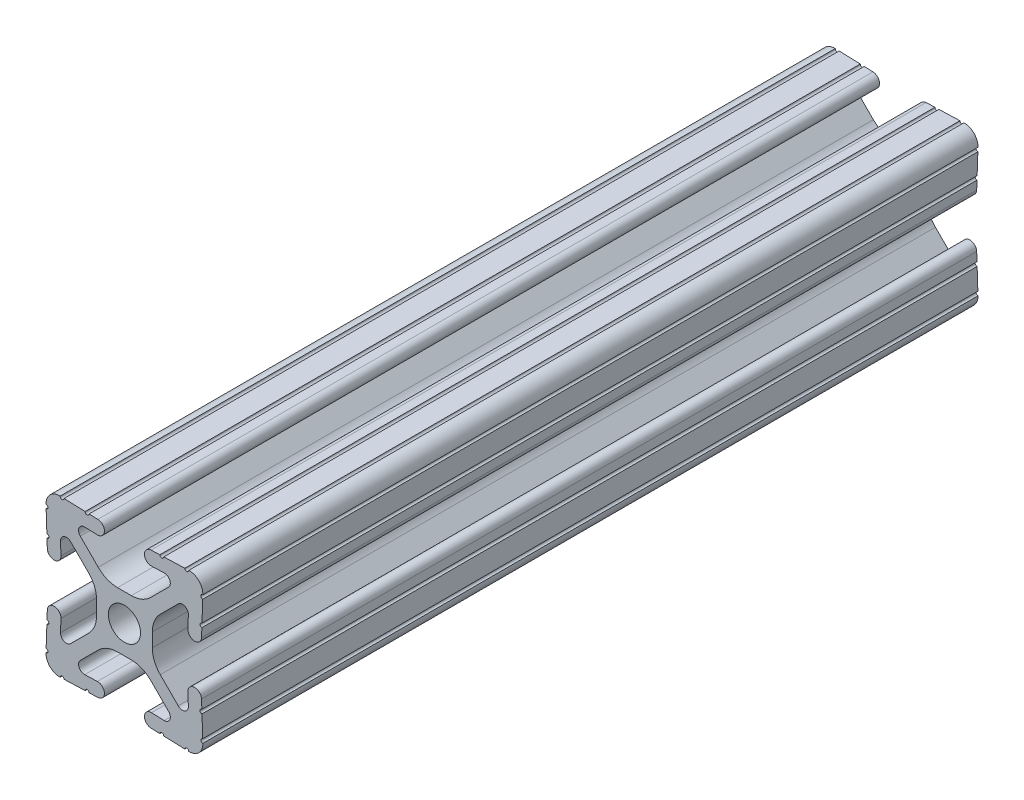
from build123d import *

# Parameters (mm, degrees)
SKETCH3_R      = 2.6035
EXTRUDE1_DEPTH = 62.75


with BuildPart() as part:
    # Sketch3 → Extrude1 (new, symmetric)
    with BuildSketch(Plane.XY):
        with BuildLine():
            Line((-1.115277175, 4.5085), (1.115277175, 4.5085))
            ThreePointArc((1.115277175, 4.5085), (2.806584872, 4.844922018), (4.240406305, 5.80297087))
            Line((4.240406305, 5.80297087), (7.148423664, 8.710988229))
            ThreePointArc((7.148423664, 8.710988229), (7.349906316, 9.772227925), (6.436353897, 10.348636575))
            Line((6.436353897, 10.348636575), (4.381960454, 10.276895575))
            ThreePointArc((4.381960454, 10.276895575), (3.239173075, 11.342562046), (4.304839546, 12.485349424))
            Line((4.304839546, 12.485349424), (5.728246175, 12.535055879))
            ThreePointArc((5.728246175, 12.535055879), (6.054756855, 12.230579745), (6.35923299, 12.557090424))
            Line((6.35923299, 12.557090424), (9.782092278, 12.676619304))
            ThreePointArc((9.782092278, 12.676619304), (10.108602958, 12.37214317), (10.413079092, 12.69865385))
            ThreePointArc((10.413079092, 12.69865385), (12.052764565, 12.052764565), (12.69865385, 10.413079092))
            ThreePointArc((12.69865385, 10.413079092), (12.37214317, 10.108602958), (12.676619304, 9.782092278))
            Line((12.676619304, 9.782092278), (12.557090424, 6.35923299))
            ThreePointArc((12.557090424, 6.35923299), (12.230579745, 6.054756855), (12.535055879, 5.728246175))
            Line((12.535055879, 5.728246175), (12.485349424, 4.304839546))
            ThreePointArc((12.485349424, 4.304839546), (11.342562046, 3.239173075), (10.276895575, 4.381960454))
            Line((10.276895575, 4.381960454), (10.348636575, 6.436353897))
            ThreePointArc((10.348636575, 6.436353897), (9.772227925, 7.349906316), (8.710988229, 7.148423664))
            Line((8.710988229, 7.148423664), (5.80297087, 4.240406305))
            ThreePointArc((5.80297087, 4.240406305), (4.844922018, 2.806584872), (4.5085, 1.115277175))
            Line((4.5085, 1.115277175), (4.5085, -1.115277175))
            ThreePointArc((4.5085, -1.115277175), (4.844922018, -2.806584872), (5.80297087, -4.240406305))
            Line((5.80297087, -4.240406305), (8.710988229, -7.148423664))
            ThreePointArc((8.710988229, -7.148423664), (9.772227925, -7.349906316), (10.348636575, -6.436353897))
            Line((10.348636575, -6.436353897), (10.276895575, -4.381960454))
            ThreePointArc((10.276895575, -4.381960454), (11.342562046, -3.239173075), (12.485349424, -4.304839546))
            Line((12.485349424, -4.304839546), (12.535055879, -5.728246175))
            ThreePointArc((12.535055879, -5.728246175), (12.230579745, -6.054756855), (12.557090424, -6.35923299))
            Line((12.557090424, -6.35923299), (12.676619304, -9.782092278))
            ThreePointArc((12.676619304, -9.782092278), (12.37214317, -10.108602958), (12.69865385, -10.413079092))
            ThreePointArc((12.69865385, -10.413079092), (12.052764565, -12.052764565), (10.413079092, -12.69865385))
            ThreePointArc((10.413079092, -12.69865385), (10.108602958, -12.37214317), (9.782092278, -12.676619304))
            Line((9.782092278, -12.676619304), (6.35923299, -12.557090424))
            ThreePointArc((6.35923299, -12.557090424), (6.054756855, -12.230579745), (5.728246175, -12.535055879))
            Line((5.728246175, -12.535055879), (4.304839546, -12.485349424))
            ThreePointArc((4.304839546, -12.485349424), (3.239173075, -11.342562046), (4.381960454, -10.276895575))
            Line((4.381960454, -10.276895575), (6.436353897, -10.348636575))
            ThreePointArc((6.436353897, -10.348636575), (7.349906316, -9.772227925), (7.148423664, -8.710988229))
            Line((7.148423664, -8.710988229), (4.240406305, -5.80297087))
            ThreePointArc((4.240406305, -5.80297087), (2.806584872, -4.844922018), (1.115277175, -4.5085))
            Line((1.115277175, -4.5085), (-1.115277175, -4.5085))
            ThreePointArc((-1.115277175, -4.5085), (-2.806584872, -4.844922018), (-4.240406305, -5.80297087))
            Line((-4.240406305, -5.80297087), (-7.148423664, -8.710988229))
            ThreePointArc((-7.148423664, -8.710988229), (-7.349906316, -9.772227925), (-6.436353897, -10.348636575))
            Line((-6.436353897, -10.348636575), (-4.381960454, -10.276895575))
            ThreePointArc((-4.381960454, -10.276895575), (-3.239173075, -11.342562046), (-4.304839546, -12.485349424))
            Line((-4.304839546, -12.485349424), (-5.728246175, -12.535055879))
            ThreePointArc((-5.728246175, -12.535055879), (-6.054756855, -12.230579745), (-6.35923299, -12.557090424))
            Line((-6.35923299, -12.557090424), (-9.782092278, -12.676619304))
            ThreePointArc((-9.782092278, -12.676619304), (-10.108602958, -12.37214317), (-10.413079092, -12.69865385))
            ThreePointArc((-10.413079092, -12.69865385), (-12.052764565, -12.052764565), (-12.69865385, -10.413079092))
            ThreePointArc((-12.69865385, -10.413079092), (-12.37214317, -10.108602958), (-12.676619304, -9.782092278))
            Line((-12.676619304, -9.782092278), (-12.557090424, -6.35923299))
            ThreePointArc((-12.557090424, -6.35923299), (-12.230579745, -6.054756855), (-12.535055879, -5.728246175))
            Line((-12.535055879, -5.728246175), (-12.485349424, -4.304839546))
            ThreePointArc((-12.485349424, -4.304839546), (-11.342562046, -3.239173075), (-10.276895575, -4.381960454))
            Line((-10.276895575, -4.381960454), (-10.348636575, -6.436353897))
            ThreePointArc((-10.348636575, -6.436353897), (-9.772227925, -7.349906316), (-8.710988229, -7.148423664))
            Line((-8.710988229, -7.148423664), (-5.80297087, -4.240406305))
            ThreePointArc((-5.80297087, -4.240406305), (-4.844922018, -2.806584872), (-4.5085, -1.115277175))
            Line((-4.5085, -1.115277175), (-4.5085, 1.115277175))
            ThreePointArc((-4.5085, 1.115277175), (-4.844922018, 2.806584872), (-5.80297087, 4.240406305))
            Line((-5.80297087, 4.240406305), (-8.710988229, 7.148423664))
            ThreePointArc((-8.710988229, 7.148423664), (-9.772227925, 7.349906316), (-10.348636575, 6.436353897))
            Line((-10.348636575, 6.436353897), (-10.276895575, 4.381960454))
            ThreePointArc((-10.276895575, 4.381960454), (-11.342562046, 3.239173075), (-12.485349424, 4.304839546))
            Line((-12.485349424, 4.304839546), (-12.535055879, 5.728246175))
            ThreePointArc((-12.535055879, 5.728246175), (-12.230579745, 6.054756855), (-12.557090424, 6.35923299))
            Line((-12.557090424, 6.35923299), (-12.676619304, 9.782092278))
            ThreePointArc((-12.676619304, 9.782092278), (-12.37214317, 10.108602958), (-12.69865385, 10.413079092))
            ThreePointArc((-12.69865385, 10.413079092), (-12.052764565, 12.052764565), (-10.413079092, 12.69865385))
            ThreePointArc((-10.413079092, 12.69865385), (-10.108602958, 12.37214317), (-9.782092278, 12.676619304))
            Line((-9.782092278, 12.676619304), (-6.35923299, 12.557090424))
            ThreePointArc((-6.35923299, 12.557090424), (-6.054756855, 12.230579745), (-5.728246175, 12.535055879))
            Line((-5.728246175, 12.535055879), (-4.304839546, 12.485349424))
            ThreePointArc((-4.304839546, 12.485349424), (-3.239173075, 11.342562046), (-4.381960454, 10.276895575))
            Line((-4.381960454, 10.276895575), (-6.436353897, 10.348636575))
            ThreePointArc((-6.436353897, 10.348636575), (-7.349906316, 9.772227925), (-7.148423664, 8.710988229))
            Line((-7.148423664, 8.710988229), (-4.240406305, 5.80297087))
            ThreePointArc((-4.240406305, 5.80297087), (-2.806584872, 4.844922018), (-1.115277175, 4.5085))
        make_face()
        Circle(SKETCH3_R, mode=Mode.SUBTRACT)
    extrude(amount=EXTRUDE1_DEPTH, both=True)


solid = part.part
